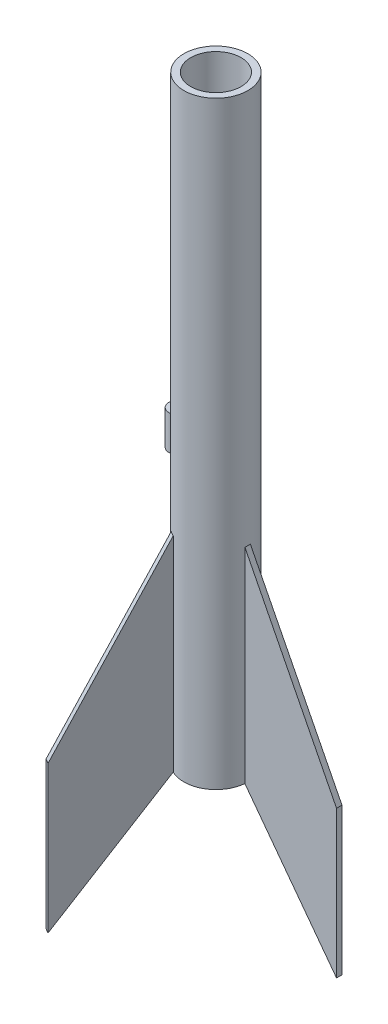
from build123d import *

# Parameters (mm, degrees)
SKETCH2_R                = 11.75
SKETCH2_R_2              = 9.25
BOSS_EXTRUDE1_DEPTH      = 220
SKETCH5_R                = 9.5
SKETCH5_R_2              = 4.625
BOSS_EXTRUDE2_DEPTH      = 12
BOSS_EXTRUDE3_DEPTH      = 1
CIRPATTERN1_COUNT        = 3
BOSS_EXTRUDE4_DEPTH      = 6.35
BOSS_EXTRUDE4_DEPTH_BACK = 6.35
SKETCH8_R                = 3.25
SKETCH8_R_2              = 1.9
SKETCH9_W                = 1
SKETCH9_H                = 16.330262046


with BuildPart() as part:
    # Sketch2 → Boss-Extrude1 (new body)
    with BuildSketch(Plane(origin=(-2.465768249, 0, -0.081027564), x_dir=(1, 0, 0), z_dir=(0, 1, 0))):
        with Locations((2.411661176, 0)):
            Circle(SKETCH2_R)
        with Locations((2.411661176, 0)):
            Circle(SKETCH2_R_2, mode=Mode.SUBTRACT)
    extrude(amount=BOSS_EXTRUDE1_DEPTH)

    # Sketch5 → Boss-Extrude2 (add)
    with BuildSketch(Plane(origin=(0, 60, 0), x_dir=(1, 0, 0), z_dir=(0, 1, 0))):
        with Locations((-0.054107074, 0.081027564)):
            Circle(SKETCH5_R)
        with Locations((-0.054107074, 0.081027564)):
            Circle(SKETCH5_R_2, mode=Mode.SUBTRACT)
    extrude(amount=BOSS_EXTRUDE2_DEPTH)

    # Sketch7 → Boss-Extrude3 (add, symmetric)
    with BuildSketch(Plane.XY):
        Polygon((11.695892926, 75.2), (9.828211369, 75.2), (10.695892926, 0), (11.695892926, 0), (45.34731611, -45), (45.34731611, 9), align=None)
    boss_extrude3 = extrude(amount=BOSS_EXTRUDE3_DEPTH, both=True)

    # CirPattern1: Boss-Extrude3 ×3 about axis
    cirpattern1_axis = Axis((-0.054107074, 220, -0.081027564), (0, -1, 0))
    for i in range(1, CIRPATTERN1_COUNT):
        add(boss_extrude3.rotate(cirpattern1_axis, i * 360 / CIRPATTERN1_COUNT))

    # Sketch8 → Boss-Extrude4 (add, two sides: drawn at the far end of the back side and taken through both)
    with BuildSketch(Plane(origin=(0.379836366, 100, 0), x_dir=(1, 0, 0), z_dir=(0, 1, 0)).offset(-BOSS_EXTRUDE4_DEPTH_BACK)):
        with Locations((-14.4, 0)):
            Circle(SKETCH8_R)
        with Locations((-14.4, 0)):
            Circle(SKETCH8_R_2, mode=Mode.SUBTRACT)
    extrude(amount=BOSS_EXTRUDE4_DEPTH + BOSS_EXTRUDE4_DEPTH_BACK)

    # Sketch9 → Revolve-Thin1 (revolve)
    with BuildSketch(Plane(origin=(0, 110, 0), x_dir=(1, 0, 0), z_dir=(0, 1, 0))):
        with Locations((-6.173250471, 0)):
            Rectangle(SKETCH9_W, SKETCH9_H)
    revolve(axis=Axis((-6.673250471, 110, -8.165131023), (0, 0, 1)))


solid = part.part
